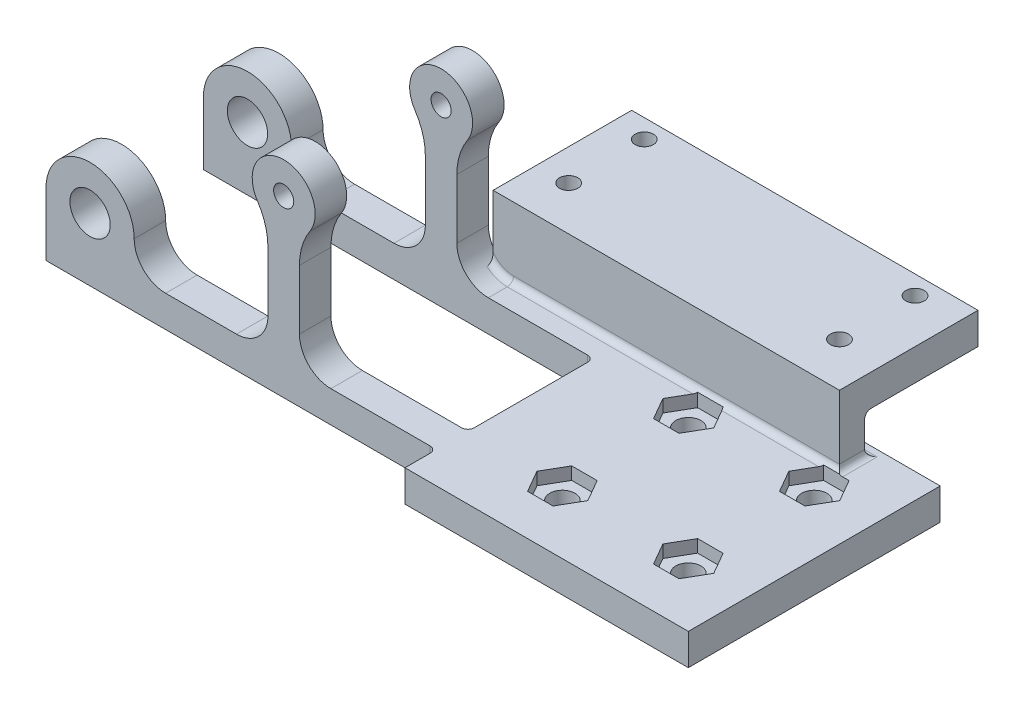
from build123d import *

# Parameters (mm, degrees)
SKETCH1_W                        = 45
SKETCH1_H                        = 40
CONNECTION_BASE_DEPTH            = 5
SKETCH9_R                        = 3.2
SKETCH9_R_2                      = 1.6
LEFT_LEG_DEPTH                   = 5
LEG_FILLET_R                     = 5
HUB_FILLET_R                     = 10
LEG_FILLET_OF_MIRROR_RIGHT_LEG_R = 5
HUB_FILLET_OF_MIRROR_RIGHT_LEG_R = 10
SKETCH2_R                        = 2
BASE_CONN_HOLE_DEPTH             = 94.482952991
BASE_CONN_NUT_DEPTH              = 2
BASE_HOLES_PATTERN_COUNT         = 2
BASE_HOLES_PATTERN_PITCH         = 20
BASE_HOLES_PATTERN_COUNT_DIR2    = 2
BASE_HOLES_PATTERN_PITCH_DIR2    = 20
SKETCH4_W                        = 55
SKETCH4_H                        = 4
MOTOR_STEP_DEPTH                 = 6.16
SKETCH5_W                        = 55
SKETCH5_H                        = 22
MOTOR_SHELF_DEPTH                = 5
MOTOR_M3_5X0_6_TAPPED_HOLE1_D    = 2.9
SMALL_INTERNAL_FILLETS_R         = 1


# Some blends are built 0.0001 mm under size
with BuildPart() as part:
    # Sketch1 → Connection_Base (new body)
    with BuildSketch(Plane(origin=(0, 0, 0), x_dir=(1, 0, 0), z_dir=(0, 1, 0))):
        with Locations((-2.5, 0)):
            Rectangle(SKETCH1_W, SKETCH1_H)
    extrude(amount=CONNECTION_BASE_DEPTH)

    # Sketch9 → LEFT_LEG (add)
    with BuildSketch(Plane.XY.offset(10)):
        with BuildLine():
            Line((-51.756098166, 5), (-73, 5))
            Line((-73, 5), (-73, 10))
            ThreePointArc((-73, 10), (-80, 17), (-87, 10))
            Line((-87, 10), (-87, 0))
            Line((-87, 0), (0, 0))
            Line((0, 0), (0, 5))
            Line((0, 5), (-46.756098166, 5))
            Line((-46.756098166, 5), (-46.756098166, 23.419872981))
            ThreePointArc((-46.756098166, 23.419872981), (-49.256098166, 32.75), (-51.756098166, 23.419872981))
            Line((-51.756098166, 23.419872981), (-51.756098166, 5))
        make_face()
        with Locations((-80, 10)):
            Circle(SKETCH9_R, mode=Mode.SUBTRACT)
        with Locations((-49.256098166, 27.75)):
            Circle(SKETCH9_R_2, mode=Mode.SUBTRACT)
    left_leg = extrude(amount=LEFT_LEG_DEPTH)

    # LEG_Fillet
    leg_fillet_edges = [part.edges().sort_by_distance(p)[0] for p in [
        (-51.756098166, 5, 12.5),
        (-46.756098166, 5, 12.5),
        (-73, 5, 12.5),
    ]]
    fillet(leg_fillet_edges, radius=LEG_FILLET_R - 0.0001)  # a hair under: the kernel refuses the full size

    # Hub_Fillet
    hub_fillet_edges = [part.edges().sort_by_distance(p)[0] for p in [
        (-46.756098166, 23.419872981, 12.5),
        (-51.756098166, 23.419872981, 12.5),
    ]]
    fillet(hub_fillet_edges, radius=HUB_FILLET_R)

    # Mirror_RIGHT_LEG: LEFT_LEG across plane
    add(left_leg.mirror(Plane.XY))

    # LEG_Fillet of Mirror_RIGHT_LEG
    leg_fillet_of_mirror_right_leg_edges = [part.edges().sort_by_distance(p)[0] for p in [
        (-51.756098166, 5, -12.5),
        (-46.756098166, 5, -12.5),
        (-73, 5, -12.5),
    ]]
    fillet(leg_fillet_of_mirror_right_leg_edges, radius=LEG_FILLET_OF_MIRROR_RIGHT_LEG_R - 0.0001)  # a hair under: the kernel refuses the full size

    # Hub_Fillet of Mirror_RIGHT_LEG
    hub_fillet_of_mirror_right_leg_edges = [part.edges().sort_by_distance(p)[0] for p in [
        (-46.756098166, 23.419872981, -12.5),
        (-51.756098166, 23.419872981, -12.5),
    ]]
    fillet(hub_fillet_of_mirror_right_leg_edges, radius=HUB_FILLET_OF_MIRROR_RIGHT_LEG_R)

    # Sketch2 → Base_Conn_Hole (cut, through all)
    with BuildSketch(Plane(origin=(0, 5, 0), x_dir=(1, 0, 0), z_dir=(0, 1, 0))):
        with Locations(Location((-10, 10, 0), (0, 0, 270))):
            Circle(SKETCH2_R)
    base_conn_hole = extrude(amount=-BASE_CONN_HOLE_DEPTH, mode=Mode.SUBTRACT)

    # Sketch3 → Base_Conn_Nut (cut)
    with BuildSketch(Plane(origin=(0, 5, 0), x_dir=(1, 0, 0), z_dir=(0, 1, 0))):
        Polygon((-7.979274058, 6.5), (-5.958548116, 10), (-7.979274058, 13.5), (-12.020725942, 13.5), (-14.041451884, 10), (-12.020725942, 6.5), align=None)
    base_conn_nut = extrude(amount=-BASE_CONN_NUT_DEPTH, mode=Mode.SUBTRACT)

    # Base_Holes_Pattern: Base_Conn_Hole, Base_Conn_Nut 2 × 2
    with Locations(*[(j * BASE_HOLES_PATTERN_PITCH_DIR2, 0, i * BASE_HOLES_PATTERN_PITCH) for i in range(BASE_HOLES_PATTERN_COUNT) for j in range(BASE_HOLES_PATTERN_COUNT_DIR2) if (i, j) != (0, 0)]):
        add(base_conn_hole, mode=Mode.SUBTRACT)
        add(base_conn_nut, mode=Mode.SUBTRACT)

    # Sketch4 → Motor_Step (add)
    with BuildSketch(Plane(origin=(0, 5, 0), x_dir=(1, 0, 0), z_dir=(0, 1, 0))):
        with Locations((-17.5, 16)):
            Rectangle(SKETCH4_W, SKETCH4_H)
    extrude(amount=MOTOR_STEP_DEPTH)

    # Sketch5 → Motor_Shelf (add)
    with BuildSketch(Plane(origin=(0, 11.16, 0), x_dir=(1, 0, 0), z_dir=(0, 1, 0))):
        with Locations((-17.5, 25)):
            Rectangle(SKETCH5_W, SKETCH5_H)
    extrude(amount=MOTOR_SHELF_DEPTH)

    # Motor_M3.5x0.6 Tapped Hole1 (through all)
    with Locations(Plane(origin=(0, 16.16, 0), x_dir=(1, 0, 0), z_dir=(0, 1, 0))):
        with Locations((3, 21), (3, 33), (-40, 33), (-40, 21)):
            Hole(MOTOR_M3_5X0_6_TAPPED_HOLE1_D / 2)

    # Small_Internal_Fillets
    # the kernel refuses this fillet: 1 mm, written as the material it adds along each edge
    with BuildSketch(Plane(origin=(-25, 0, 10), x_dir=(0, 0, -1), z_dir=(0, 1, 0)), Plane(origin=(-25, 0, 15), x_dir=(-1, 0, 0), z_dir=(0, 1, 0)), Plane(origin=(-25, 0, -10), x_dir=(-1, 0, 0), z_dir=(0, 1, 0))) as small_internal_fillets_piece_1:
        with BuildLine():
            CenterArc((SMALL_INTERNAL_FILLETS_R, SMALL_INTERNAL_FILLETS_R), SMALL_INTERNAL_FILLETS_R, 180, 90)
            Line((0, SMALL_INTERNAL_FILLETS_R), (0, 0))
            Line((0, 0), (SMALL_INTERNAL_FILLETS_R, 0))
        make_face()
    extrude(amount=5)
    with BuildSketch(Plane(origin=(-41.756198166, 9.9999, -14), x_dir=(0, -1, 0), z_dir=(1, 0, 0))) as small_internal_fillets_piece_2_section:
        with BuildLine():
            CenterArc((4.9999 - SMALL_INTERNAL_FILLETS_R, -SMALL_INTERNAL_FILLETS_R), SMALL_INTERNAL_FILLETS_R, 0, 90)
            Line((4.9999 - SMALL_INTERNAL_FILLETS_R, 0), (4.9999, 0))
            Line((4.9999, 0), (4.9999, -SMALL_INTERNAL_FILLETS_R))
        make_face()
    small_internal_fillets_piece_2 = revolve(axis=Axis((-41.756198166, 9.9999, -14), (0, 0, -1)), revolution_arc=69.099967659, mode=Mode.PRIVATE)
    small_internal_fillets_piece_2 = split(small_internal_fillets_piece_2, bisect_by=Plane(origin=(-45, 9.9999, -14), z_dir=(1, 0, 0)), keep=Keep.TOP, mode=Mode.PRIVATE)
    add(small_internal_fillets_piece_2)
    with BuildSketch(Plane(origin=(10, 5, -14), x_dir=(0, 0, 1), z_dir=(-1, 0, 0))) as small_internal_fillets_piece_3_section:
        with BuildLine():
            CenterArc((SMALL_INTERNAL_FILLETS_R, SMALL_INTERNAL_FILLETS_R), SMALL_INTERNAL_FILLETS_R, 180, 90)
            Line((0, SMALL_INTERNAL_FILLETS_R), (0, 0))
            Line((0, 0), (SMALL_INTERNAL_FILLETS_R, 0))
        make_face()
    small_internal_fillets_piece_3 = extrude(amount=51.756198166, mode=Mode.PRIVATE)
    small_internal_fillets_piece_3 = split(small_internal_fillets_piece_3, bisect_by=Plane(origin=(10, 5, -13.5), z_dir=(0, 0, -1)), keep=Keep.TOP, mode=Mode.PRIVATE)
    add(small_internal_fillets_piece_3)
    with BuildSketch(Plane(origin=(12.5, 5, -14), x_dir=(0, 0, 1), z_dir=(-1, 0, 0))) as small_internal_fillets_piece_4_section:
        with BuildLine():
            CenterArc((SMALL_INTERNAL_FILLETS_R, SMALL_INTERNAL_FILLETS_R), SMALL_INTERNAL_FILLETS_R, 180, 90)
            Line((0, SMALL_INTERNAL_FILLETS_R), (0, 0))
            Line((0, 0), (SMALL_INTERNAL_FILLETS_R, 0))
        make_face()
    small_internal_fillets_piece_4 = extrude(amount=54.256198166, mode=Mode.PRIVATE)
    small_internal_fillets_piece_4 = split(small_internal_fillets_piece_4, bisect_by=Plane(origin=(9.325961894, 5, -15.832531755), z_dir=(-0.8660254037844387, 0, -0.4999999999999999)), keep=Keep.TOP, mode=Mode.PRIVATE)
    small_internal_fillets_piece_4 = split(small_internal_fillets_piece_4, bisect_by=Plane(origin=(-3.075961894, 5, -5.007214207), z_dir=(0.8660254037844389, 0, -0.4999999999999996)), keep=Keep.TOP, mode=Mode.PRIVATE)
    add(small_internal_fillets_piece_4)
    with BuildSketch(Plane(origin=(12.5, 5, -14), x_dir=(0, 0, 1), z_dir=(-1, 0, 0))) as small_internal_fillets_piece_5_section:
        with BuildLine():
            CenterArc((SMALL_INTERNAL_FILLETS_R, SMALL_INTERNAL_FILLETS_R), SMALL_INTERNAL_FILLETS_R, 180, 90)
            Line((0, SMALL_INTERNAL_FILLETS_R), (0, 0))
            Line((0, 0), (SMALL_INTERNAL_FILLETS_R, 0))
        make_face()
    small_internal_fillets_piece_5 = extrude(amount=54.256198166, mode=Mode.PRIVATE)
    small_internal_fillets_piece_5 = split(small_internal_fillets_piece_5, bisect_by=Plane(origin=(-5.674038106, 5, -24.492785793), z_dir=(-0.8660254037844387, 0, -0.4999999999999999)), keep=Keep.TOP, mode=Mode.PRIVATE)
    add(small_internal_fillets_piece_5)
    with BuildSketch(Plane(origin=(10, 5, -18), x_dir=(1, 0, 0), z_dir=(0, 0, 1))) as small_internal_fillets_piece_6:
        with BuildLine():
            CenterArc((SMALL_INTERNAL_FILLETS_R, SMALL_INTERNAL_FILLETS_R), SMALL_INTERNAL_FILLETS_R, 180, 90)
            Line((0, SMALL_INTERNAL_FILLETS_R), (0, 0))
            Line((0, 0), (SMALL_INTERNAL_FILLETS_R, 0))
        make_face()
    extrude(amount=4)
    with BuildSketch(Plane(origin=(-25, 5, -18), x_dir=(0, 0, -1), z_dir=(1, 0, 0))) as small_internal_fillets_piece_7:
        with BuildLine():
            CenterArc((SMALL_INTERNAL_FILLETS_R, SMALL_INTERNAL_FILLETS_R), SMALL_INTERNAL_FILLETS_R, 180, 90)
            Line((0, SMALL_INTERNAL_FILLETS_R), (0, 0))
            Line((0, 0), (SMALL_INTERNAL_FILLETS_R, 0))
        make_face()
    extrude(amount=35)
    with BuildSketch(Plane(origin=(-45, 11.16, -18), x_dir=(0, -1, 0), z_dir=(1, 0, 0))) as small_internal_fillets_piece_8:
        with BuildLine():
            CenterArc((SMALL_INTERNAL_FILLETS_R, SMALL_INTERNAL_FILLETS_R), SMALL_INTERNAL_FILLETS_R, 180, 90)
            Line((0, SMALL_INTERNAL_FILLETS_R), (0, 0))
            Line((0, 0), (SMALL_INTERNAL_FILLETS_R, 0))
        make_face()
    extrude(amount=55)
    with BuildSketch(Plane(origin=(10, 5, -18), x_dir=(1, 0, 0), z_dir=(0, 0, 1))) as small_internal_fillets_piece_9a_section:
        with BuildLine():
            CenterArc((SMALL_INTERNAL_FILLETS_R, SMALL_INTERNAL_FILLETS_R), SMALL_INTERNAL_FILLETS_R, 180, 90)
            Line((0, SMALL_INTERNAL_FILLETS_R), (0, 0))
            Line((0, 0), (SMALL_INTERNAL_FILLETS_R, 0))
        make_face()
    small_internal_fillets_piece_9a = extrude(amount=6.5, mode=Mode.PRIVATE)
    small_internal_fillets_piece_9a = split(small_internal_fillets_piece_9a, bisect_by=Plane(origin=(10, 5, -14), z_dir=(0, 0, 1)), keep=Keep.TOP, mode=Mode.PRIVATE)
    small_internal_fillets_piece_9a = split(small_internal_fillets_piece_9a, bisect_by=Plane(origin=(10, 5, -13.5), z_dir=(0, 0, -1)), keep=Keep.TOP, mode=Mode.PRIVATE)
    with BuildSketch(Plane(origin=(12.5, 5, -14), x_dir=(0, 0, 1), z_dir=(-1, 0, 0))) as small_internal_fillets_piece_9b_section:
        with BuildLine():
            CenterArc((SMALL_INTERNAL_FILLETS_R, SMALL_INTERNAL_FILLETS_R), SMALL_INTERNAL_FILLETS_R, 180, 90)
            Line((0, SMALL_INTERNAL_FILLETS_R), (0, 0))
            Line((0, 0), (SMALL_INTERNAL_FILLETS_R, 0))
        make_face()
    small_internal_fillets_piece_9b = extrude(amount=54.256198166, mode=Mode.PRIVATE)
    small_internal_fillets_piece_9b = split(small_internal_fillets_piece_9b, bisect_by=Plane(origin=(10, 5, -14), z_dir=(1, 0, 0)), keep=Keep.TOP, mode=Mode.PRIVATE)
    small_internal_fillets_piece_9b = split(small_internal_fillets_piece_9b, bisect_by=Plane(origin=(11.924038106, 5, -13.667468245), z_dir=(-0.8660254037844389, 0, 0.4999999999999996)), keep=Keep.TOP, mode=Mode.PRIVATE)
    small_internal_fillets_piece_9b = split(small_internal_fillets_piece_9b, bisect_by=Plane(origin=(12.5, 5, -13.5), z_dir=(0, 0, -1)), keep=Keep.TOP, mode=Mode.PRIVATE)
    small_internal_fillets_piece_9 = small_internal_fillets_piece_9a & small_internal_fillets_piece_9b
    add(small_internal_fillets_piece_9)
    with BuildSketch(Plane(origin=(-25, 5, -18), x_dir=(0, 0, -1), z_dir=(1, 0, 0))) as small_internal_fillets_piece_10a_section:
        with BuildLine():
            CenterArc((SMALL_INTERNAL_FILLETS_R, SMALL_INTERNAL_FILLETS_R), SMALL_INTERNAL_FILLETS_R, 180, 90)
            Line((0, SMALL_INTERNAL_FILLETS_R), (0, 0))
            Line((0, 0), (SMALL_INTERNAL_FILLETS_R, 0))
        make_face()
    small_internal_fillets_piece_10a = extrude(amount=37.5, mode=Mode.PRIVATE)
    small_internal_fillets_piece_10a = split(small_internal_fillets_piece_10a, bisect_by=Plane(origin=(10, 5, -18), z_dir=(1, 0, 0)), keep=Keep.TOP, mode=Mode.PRIVATE)
    with BuildSketch(Plane(origin=(10, 5, -20.5), x_dir=(1, 0, 0), z_dir=(0, 0, 1))) as small_internal_fillets_piece_10b_section:
        with BuildLine():
            CenterArc((SMALL_INTERNAL_FILLETS_R, SMALL_INTERNAL_FILLETS_R), SMALL_INTERNAL_FILLETS_R, 180, 90)
            Line((0, SMALL_INTERNAL_FILLETS_R), (0, 0))
            Line((0, 0), (SMALL_INTERNAL_FILLETS_R, 0))
        make_face()
    small_internal_fillets_piece_10b = extrude(amount=6.5, mode=Mode.PRIVATE)
    small_internal_fillets_piece_10b = split(small_internal_fillets_piece_10b, bisect_by=Plane(origin=(10, 5, -20), z_dir=(0, 0, 1)), keep=Keep.TOP, mode=Mode.PRIVATE)
    small_internal_fillets_piece_10b = split(small_internal_fillets_piece_10b, bisect_by=Plane(origin=(10, 5, -18), z_dir=(0, 0, -1)), keep=Keep.TOP, mode=Mode.PRIVATE)
    small_internal_fillets_piece_10 = small_internal_fillets_piece_10a & small_internal_fillets_piece_10b
    add(small_internal_fillets_piece_10)


solid = part.part
